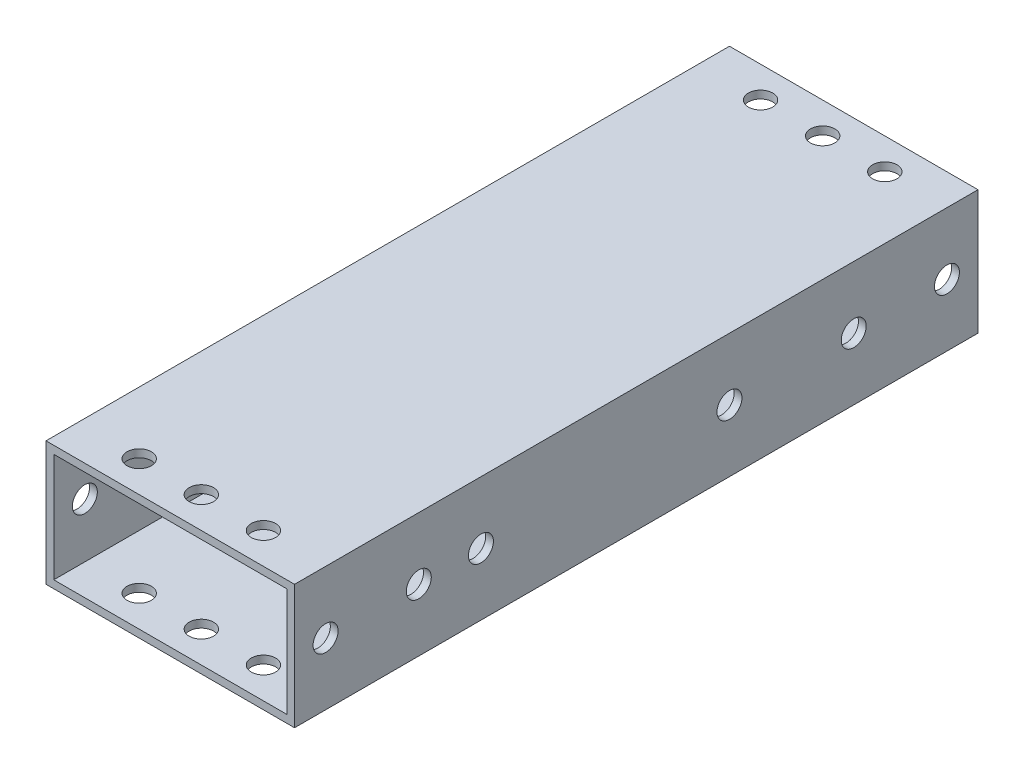
from build123d import *

# Parameters (mm, degrees)
SKETCH1_W           = 50.8
SKETCH1_H           = 25.4
SKETCH1_W_2         = 47.625
SKETCH1_H_2         = 22.225
BOSS_EXTRUDE1_DEPTH = 69.85
SKETCH2_R           = 2.4892
CUT_EXTRUDE1_DEPTH  = 79.545162168
SKETCH3_R           = 2.5527
CUT_EXTRUDE2_DEPTH  = 88.298066989
SKETCH5_R           = 2.5527
CUT_EXTRUDE3_DEPTH  = 88.298066989


with BuildPart() as part:
    # Sketch1 → Boss-Extrude1 (new, symmetric)
    with BuildSketch(Plane.XY):
        Rectangle(SKETCH1_W, SKETCH1_H)
        Rectangle(SKETCH1_W_2, SKETCH1_H_2, mode=Mode.SUBTRACT)
    extrude(amount=BOSS_EXTRUDE1_DEPTH, both=True)

    # Sketch2 → Cut-Extrude1 (cut, through all)
    with BuildSketch(Plane(origin=(0, 12.7, 0), x_dir=(1, 0, 0), z_dir=(0, 1, 0))):
        with Locations((-12.7, 63.5)):
            Circle(SKETCH2_R)
        with Locations((0, 63.5)):
            Circle(SKETCH2_R)
        with Locations((12.7, 63.5)):
            Circle(SKETCH2_R)
        with Locations((12.7, -63.5)):
            Circle(SKETCH2_R)
        with Locations((0, -63.5)):
            Circle(SKETCH2_R)
        with Locations((-12.7, -63.5)):
            Circle(SKETCH2_R)
    extrude(amount=-CUT_EXTRUDE1_DEPTH, mode=Mode.SUBTRACT)

    # Sketch3 → Cut-Extrude2 (cut, through all)
    with BuildSketch(Plane.ZY.offset(25.4)):
        with Locations((-63.5, 0)):
            Circle(SKETCH3_R)
        with Locations((63.5, 0)):
            Circle(SKETCH3_R)
        with Locations((31.75, 0)):
            Circle(SKETCH3_R)
        with Locations((44.45, 0)):
            Circle(SKETCH3_R)
    extrude(amount=-CUT_EXTRUDE2_DEPTH, mode=Mode.SUBTRACT)

    # Sketch5 → Cut-Extrude3 (cut, through all)
    with BuildSketch(Plane(origin=(25.4, 0, 0), x_dir=(0, 0, -1), z_dir=(1, 0, 0))):
        with Locations((44.45, 0)):
            Circle(SKETCH5_R)
        with Locations((19.05, 0)):
            Circle(SKETCH5_R)
    extrude(amount=-CUT_EXTRUDE3_DEPTH, mode=Mode.SUBTRACT)


solid = part.part
